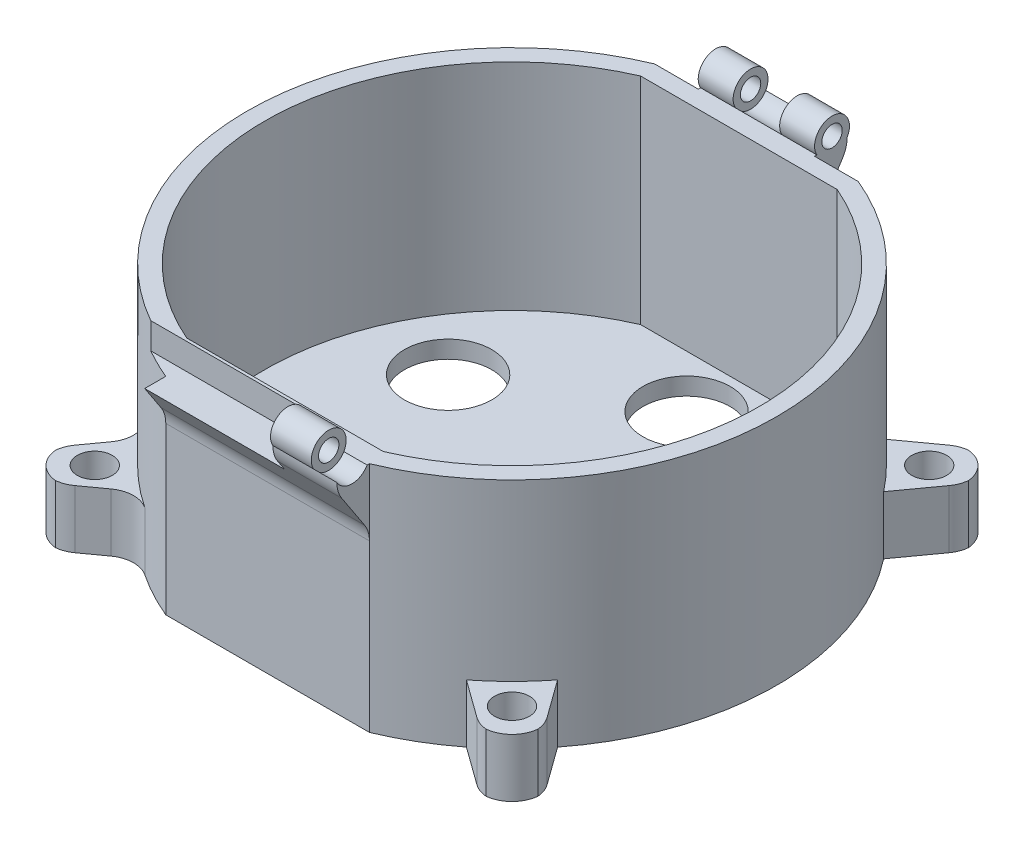
from build123d import *

# Parameters (mm, degrees)
BOSS_EXTRUDE1_DEPTH            = 40
SHELL1_T                       = -3
SKETCH2_R                      = 3
SKETCH2_R_2                    = 7.5
CUT_EXTRUDE1_DEPTH             = 3
SKETCH3_R                      = 3
BOSS_EXTRUDE2_DEPTH            = 10
FILLET1_R                      = 5
CIRPATTERN1_OUTLINE_R          = 3
CIRPATTERN1_DEPTH              = 10
SKETCH4_R                      = 1.75
BOSS_EXTRUDE3_DEPTH            = 17.5
FILLET2_R                      = 5
FILLET3_R                      = 5
SKETCH5_R                      = 3
CUT_EXTRUDE2_DEPTH             = 4
CUT_EXTRUDE3_DEPTH             = 4
CUT_EXTRUDE3_DEPTH_BACK        = 4
SKETCH6_R                      = 3
SKETCH7_W                      = 10
SKETCH7_H                      = 20
CUT_EXTRUDE4_DEPTH             = 7.5
SKETCH9_W                      = 10
SKETCH9_H                      = 25
CUT_EXTRUDE6_DEPTH             = 7.5
SKETCH8_W                      = 11
SKETCH8_H                      = 12
CUT_EXTRUDE7_DEPTH             = 24
CUT_EXTRUDE7_DIRECTION_2_REACH = 92.847


# Read off the part's stored shape, not the designer's step: CirPattern1
with BuildPart() as part:
    # Sketch1 → Boss-Extrude1 (new body)
    with BuildSketch(Plane(origin=(0, 0, 0), x_dir=(1, 0, 0), z_dir=(0, 1, 0))):
        with BuildLine():
            Line((-17.5, 42), (17.5, 42))
            ThreePointArc((17.5, 42), (45.5, 0), (17.5, -42))
            Line((17.5, -42), (-17.5, -42))
            ThreePointArc((-17.5, -42), (-45.5, 0), (-17.5, 42))
        make_face()
    extrude(amount=BOSS_EXTRUDE1_DEPTH)

    # Shell1
    shell1_openings = [part.faces().sort_by_distance(p)[0] for p in [
        (0, 40, 0),
    ]]
    offset(amount=SHELL1_T, openings=shell1_openings, kind=Kind.INTERSECTION)

    # Sketch2 → Cut-Extrude1 (cut)
    with BuildSketch(Plane(origin=(0, 3, 0), x_dir=(1, 0, 0), z_dir=(0, 1, 0))):
        with Locations(Location((0, 0, 0), (0, 0, 270))):
            Circle(SKETCH2_R)
        with Locations(Location((0, 30, 0), (0, 0, 270))):
            Circle(SKETCH2_R_2)
        with Locations(Location((25.980762114, 15, 0), (0, 0, 270))):
            Circle(SKETCH2_R_2)
        with Locations(Location((25.980762114, -15, 0), (0, 0, 270))):
            Circle(SKETCH2_R_2)
        with Locations(Location((0, -30, 0), (0, 0, 270))):
            Circle(SKETCH2_R_2)
        with Locations(Location((-25.980762114, -15, 0), (0, 0, 270))):
            Circle(SKETCH2_R_2)
        with Locations(Location((-25.980762114, 15, 0), (0, 0, 270))):
            Circle(SKETCH2_R_2)
    extrude(amount=-CUT_EXTRUDE1_DEPTH, mode=Mode.SUBTRACT)

    # Sketch3 → Boss-Extrude2 (add)
    with BuildSketch(Plane.XZ):
        with BuildLine():
            Line((-35.850313806, 28.017940681), (-41.507168056, 35.850313806))
            Line((-41.507168056, 35.850313806), (-41.507168056, 41.507168056))
            Line((-41.507168056, 41.507168056), (-35.850313806, 41.507168056))
            Line((-35.850313806, 41.507168056), (-28.017940681, 35.850313806))
            ThreePointArc((-28.017940681, 35.850313806), (-32.173358544, 32.173358544), (-35.850313806, 28.017940681))
        make_face()
        with Locations(Location((-35.850313806, 35.850313806, 0), (0, 0, 270))):
            Circle(SKETCH3_R, mode=Mode.SUBTRACT)
    extrude(amount=-BOSS_EXTRUDE2_DEPTH)

    # Fillet1
    # the kernel refuses this fillet: 5 mm, written as the material it adds along each edge
    with BuildSketch(Plane(origin=(-28.017940681, 0, 35.850313806), x_dir=(0.8105373937900577, 0, 0.585686890128182), z_dir=(0, 1, 0))) as fillet1_piece_1:
        with BuildLine():
            CenterArc((3.613249721, -4.996457194), FILLET1_R, 92.157009058, 69.532849002)
            Line((-1.133599694, -3.425654648), (0, 0))
            ThreePointArc((0, 0), (1.712529816, -0.032239536), (3.425059631, 0))
        make_face()
    extrude(amount=10)
    with BuildSketch(Plane(origin=(-35.850313806, 0, 28.017940681), x_dir=(-0.5856868901281832, 0, -0.8105373937900566), z_dir=(0, 1, 0))) as fillet1_piece_2:
        with BuildLine():
            CenterArc((3.613249721, 4.996457194), FILLET1_R, 198.31014194, 69.532849002)
            Line((-1.133599694, 3.425654648), (0, 0))
            ThreePointArc((0, 0), (1.712529816, 0.032239536), (3.425059631, 0))
        make_face()
    extrude(amount=10)
    # the kernel refuses this fillet: 5 mm, written as the material it takes off along each edge
    with BuildSketch(Plane(origin=(-41.507168056, -12.5, 41.507168056), x_dir=(1, 0, 0), z_dir=(0, 1, 0))) as fillet1_2_piece_1:
        with BuildLine():
            CenterArc((FILLET1_R, FILLET1_R), FILLET1_R, 180, 90)
            Line((0, FILLET1_R), (0, 0))
            Line((0, 0), (FILLET1_R, 0))
        make_face()
    extrude(amount=35, mode=Mode.SUBTRACT)
    with BuildSketch(Plane(origin=(-35.850313806, -4.042007545, 41.507168056), x_dir=(0.8106723345515203, 0, -0.5855000990544645), z_dir=(0, 1, 0)), Plane(origin=(-41.507168056, -4.042007545, 35.850313806), x_dir=(0, 0, 1), z_dir=(0, 1, 0))) as fillet1_2_piece_2:
        with BuildLine():
            CenterArc((FILLET1_R * 0.323360603618, FILLET1_R), FILLET1_R, 234.161672423, 35.838327577)
            Line((-FILLET1_R * 0.262139495437, FILLET1_R * 0.189327665448), (0, 0))
            Line((0, 0), (FILLET1_R * 0.323360603618, 0))
        make_face()
    extrude(amount=18.08401509, mode=Mode.SUBTRACT)

    # CirPattern1 outline → CirPattern1 (add)
    # profile 1 of 3: a face of its own
    with BuildSketch(Plane(origin=(0, 0, 0), x_dir=(1, 0, 0), z_dir=(0, 1, 0))):
        with BuildLine():
            ThreePointArc((35.850313806, -28.017940681), (32.173358544, -32.173358544), (28.017940681, -35.850313806))
            Line((28.017940681, -35.850313806), (34.539616329, -40.560529728))
            ThreePointArc((34.539616329, -40.560529728), (35.701909685, -41.185206507), (36.98714244, -41.484077196))
            ThreePointArc((36.98714244, -41.484077196), (40.042701962, -40.042701962), (41.484077196, -36.98714244))
            ThreePointArc((41.484077196, -36.98714244), (41.185206507, -35.701909685), (40.560529728, -34.539616329))
            Line((40.560529728, -34.539616329), (35.850313806, -28.017940681))
        make_face()
        with Locations((35.850313806, -35.850313806)):
            Circle(CIRPATTERN1_OUTLINE_R, mode=Mode.SUBTRACT)
    # profile 2 of 3: a face of its own
    with BuildSketch(Plane(origin=(0, 0, 0), x_dir=(1, 0, 0), z_dir=(0, 1, 0))):
        with BuildLine():
            ThreePointArc((28.017940681, 35.850313806), (32.173358544, 32.173358544), (35.850313806, 28.017940681))
            Line((35.850313806, 28.017940681), (40.560529728, 34.539616329))
            ThreePointArc((40.560529728, 34.539616329), (41.185206507, 35.701909685), (41.484077196, 36.98714244))
            ThreePointArc((41.484077196, 36.98714244), (40.042701962, 40.042701962), (36.98714244, 41.484077196))
            ThreePointArc((36.98714244, 41.484077196), (35.701909685, 41.185206507), (34.539616329, 40.560529728))
            Line((34.539616329, 40.560529728), (28.017940681, 35.850313806))
        make_face()
        with Locations((35.850313806, 35.850313806)):
            Circle(CIRPATTERN1_OUTLINE_R, mode=Mode.SUBTRACT)
    # profile 3 of 3: a face of its own
    with BuildSketch(Plane(origin=(0, 0, 0), x_dir=(1, 0, 0), z_dir=(0, 1, 0))):
        with BuildLine():
            ThreePointArc((-25.241801774, 37.85632633), (-28.109161878, 37.01723716), (-30.94312664, 37.963000518))
            Line((-30.94312664, 37.963000518), (-34.539616329, 40.560529728))
            ThreePointArc((-34.539616329, 40.560529728), (-35.701909685, 41.185206507), (-36.98714244, 41.484077196))
            ThreePointArc((-36.98714244, 41.484077196), (-40.042701962, 40.042701962), (-41.484077196, 36.98714244))
            ThreePointArc((-41.484077196, 36.98714244), (-41.185206507, 35.701909685), (-40.560529728, 34.539616329))
            Line((-40.560529728, 34.539616329), (-37.963000518, 30.94312664))
            ThreePointArc((-37.963000518, 30.94312664), (-37.01723716, 28.109161878), (-37.85632633, 25.241801774))
            ThreePointArc((-37.85632633, 25.241801774), (-32.173358544, 32.173358544), (-25.241801774, 37.85632633))
        make_face()
        with Locations((-35.850313806, 35.850313806)):
            Circle(CIRPATTERN1_OUTLINE_R, mode=Mode.SUBTRACT)
    extrude(amount=CIRPATTERN1_DEPTH)

    # Sketch4 → Boss-Extrude3 (add, symmetric)
    with BuildSketch(Plane(origin=(0, 0, 0), x_dir=(0, 0, -1), z_dir=(1, 0, 0))):
        with BuildLine():
            Line((-42, 30), (-47.598076211, 38.5))
            Line((-47.598076211, 38.5), (-47.598076211, 40))
            ThreePointArc((-47.598076211, 40), (-45, 44.5), (-42.401923789, 40))
            Line((-42.401923789, 40), (-42, 40))
            Line((-42, 40), (-42, 30))
        make_face()
        with Locations((-45, 41.5)):
            Circle(SKETCH4_R, mode=Mode.SUBTRACT)
    boss_extrude3 = extrude(amount=BOSS_EXTRUDE3_DEPTH, both=True)

    # Fillet2
    fillet2_edges = [part.edges().sort_by_distance(p)[0] for p in [
        (0, 30, 42),
        (0, 38.5, 47.598076211),
    ]]
    fillet(fillet2_edges, radius=FILLET2_R)

    # Mirror1: Boss-Extrude3 across plane
    add(boss_extrude3.mirror(Plane.XY))

    # Fillet3
    fillet3_edges = [part.edges().sort_by_distance(p)[0] for p in [
        (0, 30, -42),
        (0, 38.5, -47.598076211),
    ]]
    fillet(fillet3_edges, radius=FILLET3_R)

    # Sketch5 → Cut-Extrude2 (cut)
    with BuildSketch(Plane(origin=(17.5, 0, 0), x_dir=(0, 0, -1), z_dir=(1, 0, 0))):
        with Locations((-45, 41.5)):
            Circle(SKETCH5_R)
    extrude(amount=-CUT_EXTRUDE2_DEPTH, mode=Mode.SUBTRACT)

    # Sketch6 → Cut-Extrude3 (cut, two sides: drawn at the far end of the back side and taken through both)
    with BuildSketch(Plane(origin=(0, 0, 0), x_dir=(0, 0, -1), z_dir=(1, 0, 0)).offset(-CUT_EXTRUDE3_DEPTH_BACK)):
        with Locations((45, 41.5)):
            Circle(SKETCH6_R)
    extrude(amount=CUT_EXTRUDE3_DEPTH + CUT_EXTRUDE3_DEPTH_BACK, mode=Mode.SUBTRACT)

    # Sketch7 → Cut-Extrude4 (cut)
    with BuildSketch(Plane.ZY.offset(17.5)):
        with Locations((-47, 38.501412431)):
            Rectangle(SKETCH7_W, SKETCH7_H)
    extrude(amount=-CUT_EXTRUDE4_DEPTH, mode=Mode.SUBTRACT)

    # Sketch9 → Cut-Extrude6 (cut)
    with BuildSketch(Plane(origin=(17.5, 0, 0), x_dir=(0, 0, -1), z_dir=(1, 0, 0))):
        with Locations((47, 38.001412431)):
            Rectangle(SKETCH9_W, SKETCH9_H)
    extrude(amount=-CUT_EXTRUDE6_DEPTH, mode=Mode.SUBTRACT)

    # Sketch8 → Cut-Extrude7 (cut)
    with BuildSketch(Plane.ZY.offset(17.5)):
        with Locations((45, 41.5)):
            Rectangle(SKETCH8_W, SKETCH8_H)
    extrude(amount=-CUT_EXTRUDE7_DEPTH, mode=Mode.SUBTRACT)

    # Sketch8 → Cut-Extrude7 direction 2 (cut, up to next)
    with BuildSketch(Plane.ZY.offset(17.5), mode=Mode.PRIVATE) as cut_extrude7_direction_2_sk1:
        with Locations((45, 41.5)):
            Rectangle(SKETCH8_W, SKETCH8_H)
    cut_extrude7_direction_2_tool1 = extrude(cut_extrude7_direction_2_sk1.sketch, amount=CUT_EXTRUDE7_DIRECTION_2_REACH, mode=Mode.PRIVATE) & part.part
    add(cut_extrude7_direction_2_tool1.solids().sort_by_distance((-17.5, 41.5, 45))[0], mode=Mode.SUBTRACT)


solid = part.part
